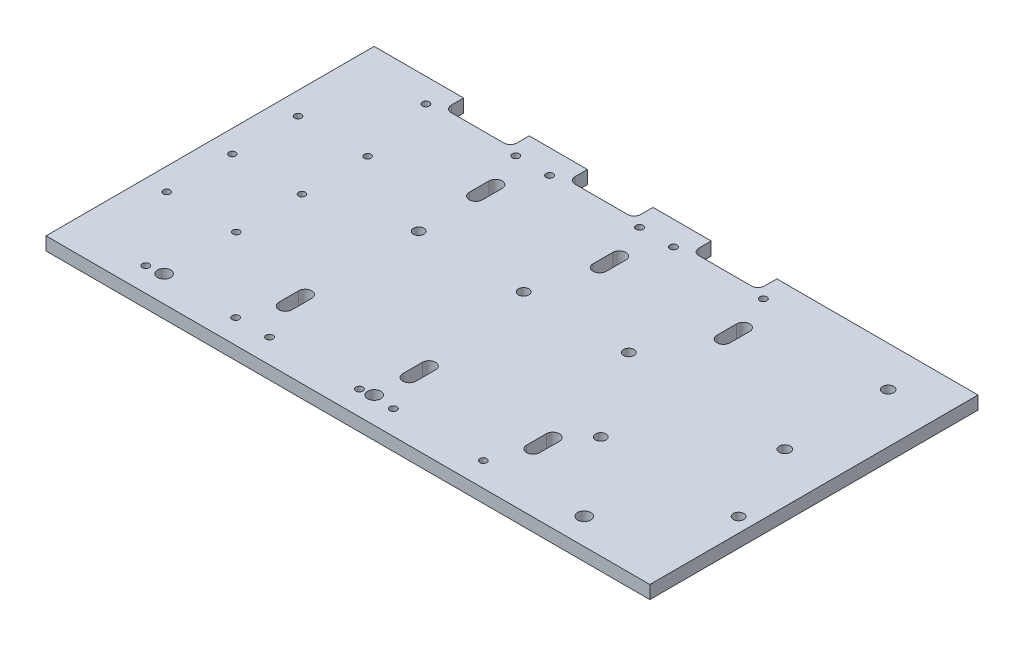
from build123d import *

# Parameters (mm, degrees)
SKETCH1_W           = 292.1
SKETCH1_H           = 158.75
BOSS_EXTRUDE1_DEPTH = 6.35
SKETCH2_R           = 3.175
CUT_EXTRUDE2_DEPTH  = 6.35
SKETCH4_R           = 2.54
SKETCH4_R_2         = 1.651
SKETCH4_R_3         = 2.667
CUT_EXTRUDE5_DEPTH  = 333.512097524


with BuildPart() as part:
    # Sketch1 → Boss-Extrude1 (new body)
    with BuildSketch(Plane(origin=(0, 0, 0), x_dir=(1, 0, 0), z_dir=(0, 1, 0))):
        with Locations((146.05, 79.375)):
            Rectangle(SKETCH1_W, SKETCH1_H)
    extrude(amount=BOSS_EXTRUDE1_DEPTH)

    # Sketch2 → Cut-Extrude2 (cut)
    with BuildSketch(Plane(origin=(0, 6.35, 0), x_dir=(1, 0, 0), z_dir=(0, 1, 0))):
        with Locations((146.05, 12.7)):
            Circle(SKETCH2_R)
        with Locations((247.65, 12.7)):
            Circle(SKETCH2_R)
        with Locations((44.45, 12.7)):
            Circle(SKETCH2_R)
    extrude(amount=-CUT_EXTRUDE2_DEPTH, mode=Mode.SUBTRACT)

    # Sketch4 → Cut-Extrude5 (cut, through all)
    with BuildSketch(Plane(origin=(0, 6.35, 0), x_dir=(1, 0, 0), z_dir=(0, 1, 0))):
        with Locations((88.2015, 92.075)):
            Circle(SKETCH4_R)
        with Locations((44.45, 111.125)):
            Circle(SKETCH4_R_2)
        with Locations((44.45, 79.375)):
            Circle(SKETCH4_R_2)
        with Locations((44.45, 47.625)):
            Circle(SKETCH4_R_2)
        with Locations((10.795, 111.125)):
            Circle(SKETCH4_R_2)
        with Locations((10.795, 79.375)):
            Circle(SKETCH4_R_2)
        with Locations((10.795, 47.625)):
            Circle(SKETCH4_R_2)
        with Locations((139.0015, 92.075)):
            Circle(SKETCH4_R)
        with Locations((189.8015, 92.075)):
            Circle(SKETCH4_R)
        with Locations((218.4146, 49.9364)):
            Circle(SKETCH4_R)
        with Locations((285.0896, 49.9364)):
            Circle(SKETCH4_R)
        with Locations((268.097, 139.3)):
            Circle(SKETCH4_R_3)
        with Locations((268.097, 89.3)):
            Circle(SKETCH4_R_3)
        with BuildLine():
            add(Edge.make_bspline(
                [(96.510303242, 145.425000436), (99.910301522, 145.425000559), (99.910301399, 148.824998839), (96.510303119, 148.824998716), (93.110304839, 148.824998594), (93.110304962, 145.425000314), (96.510303242, 145.425000436)],
                knots=[0, 0, 0, 0, 0.5, 0.5, 0.5, 1, 1, 1, 1], degree=3, weights=[1, 0.333333333, 0.333333333, 1, 0.333333333, 0.333333333, 1]))
        make_face()
        with BuildLine():
            add(Edge.make_bspline(
                [(80.116402602, 145.425002009), (83.516400882, 145.425002132), (83.516400759, 148.825000412), (80.116402479, 148.825000289), (76.716404199, 148.825000166), (76.716404322, 145.425001886), (80.116402602, 145.425002009)],
                knots=[0, 0, 0, 0, 0.5, 0.5, 0.5, 1, 1, 1, 1], degree=3, weights=[1, 0.333333333, 0.333333333, 1, 0.333333333, 0.333333333, 1]))
        make_face()
        with BuildLine():
            add(Edge.make_bspline(
                [(36.616403242, 145.425000436), (40.016401522, 145.425000559), (40.016401399, 148.824998839), (36.616403119, 148.824998716), (33.216404839, 148.824998594), (33.216404962, 145.425000314), (36.616403242, 145.425000436)],
                knots=[0, 0, 0, 0, 0.5, 0.5, 0.5, 1, 1, 1, 1], degree=3, weights=[1, 0.333333333, 0.333333333, 1, 0.333333333, 0.333333333, 1]))
        make_face()
        with BuildLine():
            add(Edge.make_bspline(
                [(140.010302602, 145.425002009), (143.410300882, 145.425002132), (143.410300759, 148.825000412), (140.010302479, 148.825000289), (136.610304199, 148.825000166), (136.610304322, 145.425001886), (140.010302602, 145.425002009)],
                knots=[0, 0, 0, 0, 0.5, 0.5, 0.5, 1, 1, 1, 1], degree=3, weights=[1, 0.333333333, 0.333333333, 1, 0.333333333, 0.333333333, 1]))
        make_face()
        with BuildLine():
            add(Edge.make_bspline(
                [(156.404203242, 145.425000436), (159.804201522, 145.425000559), (159.804201399, 148.824998839), (156.404203119, 148.824998716), (153.004204839, 148.824998594), (153.004204962, 145.425000314), (156.404203242, 145.425000436)],
                knots=[0, 0, 0, 0, 0.5, 0.5, 0.5, 1, 1, 1, 1], degree=3, weights=[1, 0.333333333, 0.333333333, 1, 0.333333333, 0.333333333, 1]))
        make_face()
        with BuildLine():
            add(Edge.make_bspline(
                [(199.904202602, 145.425002009), (203.304200882, 145.425002132), (203.304200759, 148.825000412), (199.904202479, 148.825000289), (196.504204199, 148.825000166), (196.504204322, 145.425001886), (199.904202602, 145.425002009)],
                knots=[0, 0, 0, 0, 0.5, 0.5, 0.5, 1, 1, 1, 1], degree=3, weights=[1, 0.333333333, 0.333333333, 1, 0.333333333, 0.333333333, 1]))
        make_face()
        with BuildLine():
            add(Edge.make_bspline(
                [(140.010307501, 9.925001229), (143.410305781, 9.925001352), (143.410305658, 13.324999632), (140.010307378, 13.324999509), (136.610309098, 13.324999386), (136.610309221, 9.925001106), (140.010307501, 9.925001229)],
                knots=[0, 0, 0, 0, 0.5, 0.5, 0.5, 1, 1, 1, 1], degree=3, weights=[1, 0.333333333, 0.333333333, 1, 0.333333333, 0.333333333, 1]))
        make_face()
        with BuildLine():
            add(Edge.make_bspline(
                [(96.510308141, 9.924999656), (99.910306421, 9.924999779), (99.910306298, 13.324998059), (96.510308018, 13.324997936), (93.110309738, 13.324997814), (93.110309861, 9.924999534), (96.510308141, 9.924999656)],
                knots=[0, 0, 0, 0, 0.5, 0.5, 0.5, 1, 1, 1, 1], degree=3, weights=[1, 0.333333333, 0.333333333, 1, 0.333333333, 0.333333333, 1]))
        make_face()
        with BuildLine():
            add(Edge.make_bspline(
                [(80.116407501, 9.925001229), (83.516405781, 9.925001352), (83.516405658, 13.324999632), (80.116407378, 13.324999509), (76.716409098, 13.324999386), (76.716409221, 9.925001106), (80.116407501, 9.925001229)],
                knots=[0, 0, 0, 0, 0.5, 0.5, 0.5, 1, 1, 1, 1], degree=3, weights=[1, 0.333333333, 0.333333333, 1, 0.333333333, 0.333333333, 1]))
        make_face()
        with BuildLine():
            add(Edge.make_bspline(
                [(36.616408141, 9.924999656), (40.016406421, 9.924999779), (40.016406298, 13.324998059), (36.616408018, 13.324997936), (33.216409738, 13.324997814), (33.216409861, 9.924999534), (36.616408141, 9.924999656)],
                knots=[0, 0, 0, 0, 0.5, 0.5, 0.5, 1, 1, 1, 1], degree=3, weights=[1, 0.333333333, 0.333333333, 1, 0.333333333, 0.333333333, 1]))
        make_face()
        with BuildLine():
            add(Edge.make_bspline(
                [(156.404208141, 9.924999656), (159.804206421, 9.924999779), (159.804206298, 13.324998059), (156.404208018, 13.324997936), (153.004209738, 13.324997814), (153.004209861, 9.924999534), (156.404208141, 9.924999656)],
                knots=[0, 0, 0, 0, 0.5, 0.5, 0.5, 1, 1, 1, 1], degree=3, weights=[1, 0.333333333, 0.333333333, 1, 0.333333333, 0.333333333, 1]))
        make_face()
        with BuildLine():
            add(Edge.make_bspline(
                [(199.904207501, 9.925001229), (203.304205781, 9.925001352), (203.304205658, 13.324999632), (199.904207378, 13.324999509), (196.504209098, 13.324999386), (196.504209221, 9.925001106), (199.904207501, 9.925001229)],
                knots=[0, 0, 0, 0, 0.5, 0.5, 0.5, 1, 1, 1, 1], degree=3, weights=[1, 0.333333333, 0.333333333, 1, 0.333333333, 0.333333333, 1]))
        make_face()
        with BuildLine():
            Line((150.36028937, 130.175), (150.36028937, 120.65))
            ThreePointArc((150.36028937, 120.65), (147.18528937, 117.475), (144.01028937, 120.65))
            Line((144.01028937, 120.65), (144.01028937, 130.175))
            ThreePointArc((144.01028937, 130.175), (147.18528937, 133.35), (150.36028937, 130.175))
        make_face()
        with BuildLine():
            Line((210.25418937, 130.175), (210.25418937, 120.65))
            ThreePointArc((210.25418937, 120.65), (207.07918937, 117.475), (203.90418937, 120.65))
            Line((203.90418937, 120.65), (203.90418937, 130.175))
            ThreePointArc((203.90418937, 130.175), (207.07918937, 133.35), (210.25418937, 130.175))
        make_face()
        with BuildLine():
            Line((90.46638937, 130.175), (90.46638937, 120.65))
            ThreePointArc((90.46638937, 120.65), (87.29138937, 117.475), (84.11638937, 120.65))
            Line((84.11638937, 120.65), (84.11638937, 130.175))
            ThreePointArc((84.11638937, 130.175), (87.29138937, 133.35), (90.46638937, 130.175))
        make_face()
        with BuildLine():
            Line((90.46638937, 38.1), (90.46638937, 28.575))
            ThreePointArc((90.46638937, 28.575), (87.29138937, 25.4), (84.11638937, 28.575))
            Line((84.11638937, 28.575), (84.11638937, 38.1))
            ThreePointArc((84.11638937, 38.1), (87.29138937, 41.275), (90.46638937, 38.1))
        make_face()
        with BuildLine():
            Line((210.25418937, 38.1), (210.25418937, 28.575))
            ThreePointArc((210.25418937, 28.575), (207.07918937, 25.4), (203.90418937, 28.575))
            Line((203.90418937, 28.575), (203.90418937, 38.1))
            ThreePointArc((203.90418937, 38.1), (207.07918937, 41.275), (210.25418937, 38.1))
        make_face()
        with BuildLine():
            Line((150.36028937, 38.1), (150.36028937, 28.575))
            ThreePointArc((150.36028937, 28.575), (147.18528937, 25.4), (144.01028937, 28.575))
            Line((144.01028937, 28.575), (144.01028937, 38.1))
            ThreePointArc((144.01028937, 38.1), (147.18528937, 41.275), (150.36028937, 38.1))
        make_face()
        with BuildLine():
            Line((191.604200437, 149.62500476), (166.204200437, 149.62500126))
            ThreePointArc((166.204200437, 149.62500126), (163.959136124, 150.554937076), (163.0292, 152.80000126))
            Line((163.0292, 152.80000126), (163.0292, 158.75))
            Line((163.0292, 158.75), (194.7792, 158.75))
            Line((194.7792, 158.75), (194.7792, 152.80000126))
            ThreePointArc((194.7792, 152.80000126), (193.849261711, 150.554939859), (191.604200437, 149.62500476))
        make_face()
        with BuildLine():
            Line((131.710300344, 149.62500476), (106.31030053, 149.62500126))
            ThreePointArc((106.31030053, 149.62500126), (104.065236217, 150.554937076), (103.135300093, 152.80000126))
            Line((103.135300093, 152.80000126), (103.135300093, 158.75))
            Line((103.135300093, 158.75), (134.885299907, 158.75))
            Line((134.885299907, 158.75), (134.885299907, 152.80000126))
            ThreePointArc((134.885299907, 152.80000126), (133.955361618, 150.554939859), (131.710300344, 149.62500476))
        make_face()
        with BuildLine():
            Line((71.8164, 149.62500476), (46.416400437, 149.62500126))
            ThreePointArc((46.416400437, 149.62500126), (44.171336407, 150.55493723), (43.241400437, 152.80000126))
            Line((43.241400437, 152.80000126), (43.241400437, 158.75))
            Line((43.241400437, 158.75), (74.991399563, 158.75))
            Line((74.991399563, 158.75), (74.991399563, 152.80000126))
            ThreePointArc((74.991399563, 152.80000126), (74.061461273, 150.554939859), (71.8164, 149.62500476))
        make_face()
    extrude(amount=-CUT_EXTRUDE5_DEPTH, mode=Mode.SUBTRACT)


solid = part.part
